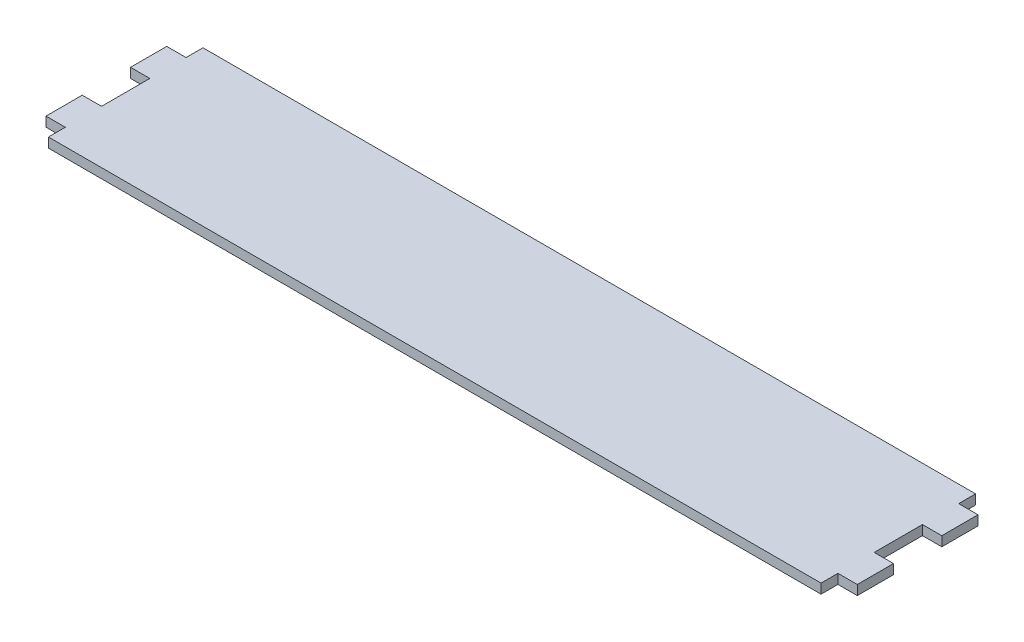
from build123d import *

# Parameters (mm, degrees)
SKIZZE1_W                       = 320
SKIZZE1_H                       = 64
GRUNDFORM_DEPTH                 = 4
SKIZZE3_W                       = 15
SKIZZE3_H                       = 4
AUFSATZ_LINEAR_AUSTRAGEN2_DEPTH = 8


with BuildPart() as part:
    # Skizze1 → Grundform (new body)
    with BuildSketch(Plane(origin=(0, 0, 0), x_dir=(1, 0, 0), z_dir=(0, 1, 0))):
        Rectangle(SKIZZE1_W, SKIZZE1_H)
    extrude(amount=GRUNDFORM_DEPTH)

    # Skizze3 → Aufsatz-Linear austragen2 (add)
    with BuildSketch(Plane.ZY.offset(160)):
        with Locations((-17.5, 2)):
            Rectangle(SKIZZE3_W, SKIZZE3_H)
        with Locations((17.5, 2)):
            Rectangle(SKIZZE3_W, SKIZZE3_H)
    aufsatz_linear_austragen2 = extrude(amount=AUFSATZ_LINEAR_AUSTRAGEN2_DEPTH)

    # Spiegeln1: Aufsatz-Linear austragen2 across plane
    add(aufsatz_linear_austragen2.mirror(Plane(origin=(0, 0, 0), x_dir=(0, 0, 1), z_dir=(1, 0, 0))))


solid = part.part
